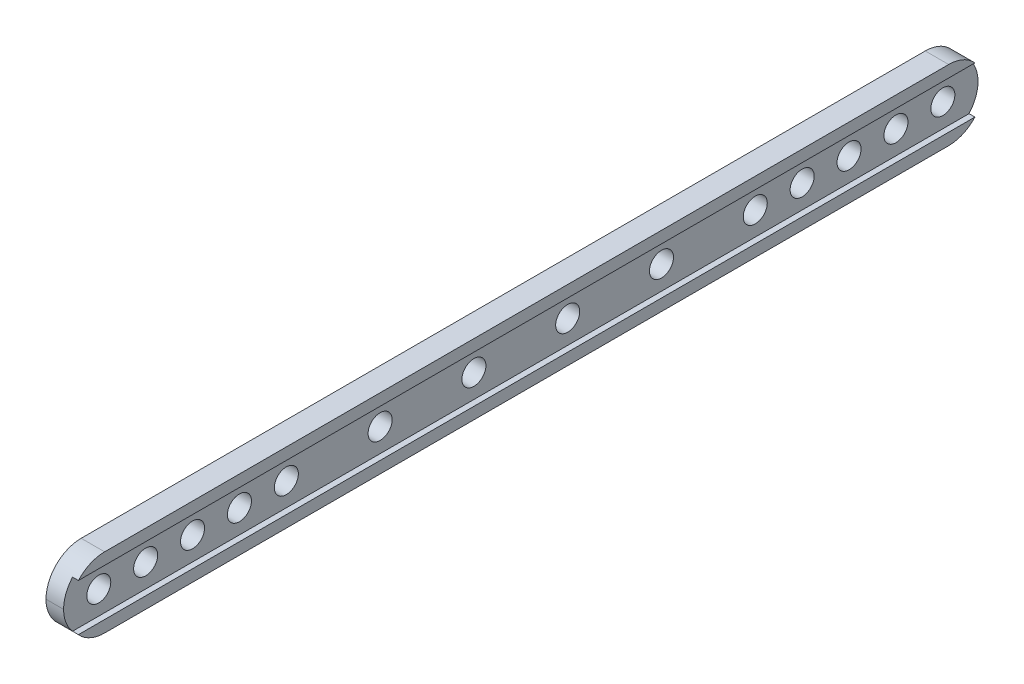
from build123d import *

# Parameters (mm, degrees)
BOSS_EXTRUDE1_DEPTH     = 156
FILLET1_R               = 6
SKETCH2_R               = 2.05
CUT_EXTRUDE1_DEPTH      = 157.511980372
LPATTERN1_COUNT         = 9
LPATTERN1_PITCH         = 8
MIRROR1_COPY_1_SKETCH_R = 2.05
MIRROR1_COPY_1_DEPTH    = 157.511980372
MIRROR1_COPY_2_SKETCH_R = 2.05
MIRROR1_COPY_2_DEPTH    = 157.511980372
MIRROR1_COPY_3_SKETCH_R = 2.05
MIRROR1_COPY_3_DEPTH    = 157.511980372
MIRROR1_COPY_4_SKETCH_R = 2.05
MIRROR1_COPY_4_DEPTH    = 157.511980372
MIRROR1_COPY_5_SKETCH_R = 2.05
MIRROR1_COPY_5_DEPTH    = 157.511980372
MIRROR1_COPY_6_SKETCH_R = 2.05
MIRROR1_COPY_6_DEPTH    = 157.511980372


with BuildPart() as part:
    # Sketch1 → Boss-Extrude1 (new body)
    with BuildSketch(Plane.XY):
        Polygon((0, 0), (4, 0), (4, 2), (3, 2), (3, 10), (4, 10), (4, 12), (0, 12), align=None)
    extrude(amount=-BOSS_EXTRUDE1_DEPTH)

    # Fillet1
    fillet1_edges = [part.edges().sort_by_distance(p)[0] for p in [
        (2, 12, 0),
        (2, 0, 0),
        (2, 0, -156),
        (2, 12, -156),
    ]]
    fillet(fillet1_edges, radius=FILLET1_R - 0.0001)  # a hair under: the kernel refuses the full size

    # Sketch2 → Cut-Extrude1 (cut, through all)
    with BuildSketch(Plane.ZY):
        with Locations(Location((-150, 6, 0), (0, 0, 270))):
            Circle(SKETCH2_R)
    cut_extrude1 = extrude(amount=-CUT_EXTRUDE1_DEPTH, mode=Mode.SUBTRACT)

    # LPattern1: Cut-Extrude1 ×9, 2 skipped
    with Locations(*[(0, 0, i * LPATTERN1_PITCH) for i in range(1, LPATTERN1_COUNT) if i not in (5, 7)]):
        add(cut_extrude1, mode=Mode.SUBTRACT)

    # Mirror1: Cut-Extrude1 across plane
    add(cut_extrude1.mirror(Plane.XY.offset(-78)), mode=Mode.SUBTRACT)

    # Mirror1 copy 1 sketch → Mirror1 copy 1 (cut, through all)
    with BuildSketch(Plane(origin=(0, 0, -164), x_dir=(0, 0, -1), z_dir=(-1, 0, 0))):
        with Locations((-150, -6)):
            Circle(MIRROR1_COPY_1_SKETCH_R)
    extrude(amount=-MIRROR1_COPY_1_DEPTH, mode=Mode.SUBTRACT)

    # Mirror1 copy 2 sketch → Mirror1 copy 2 (cut, through all)
    with BuildSketch(Plane(origin=(0, 0, -172), x_dir=(0, 0, -1), z_dir=(-1, 0, 0))):
        with Locations((-150, -6)):
            Circle(MIRROR1_COPY_2_SKETCH_R)
    extrude(amount=-MIRROR1_COPY_2_DEPTH, mode=Mode.SUBTRACT)

    # Mirror1 copy 3 sketch → Mirror1 copy 3 (cut, through all)
    with BuildSketch(Plane(origin=(0, 0, -180), x_dir=(0, 0, -1), z_dir=(-1, 0, 0))):
        with Locations((-150, -6)):
            Circle(MIRROR1_COPY_3_SKETCH_R)
    extrude(amount=-MIRROR1_COPY_3_DEPTH, mode=Mode.SUBTRACT)

    # Mirror1 copy 4 sketch → Mirror1 copy 4 (cut, through all)
    with BuildSketch(Plane(origin=(0, 0, -188), x_dir=(0, 0, -1), z_dir=(-1, 0, 0))):
        with Locations((-150, -6)):
            Circle(MIRROR1_COPY_4_SKETCH_R)
    extrude(amount=-MIRROR1_COPY_4_DEPTH, mode=Mode.SUBTRACT)

    # Mirror1 copy 5 sketch → Mirror1 copy 5 (cut, through all)
    with BuildSketch(Plane(origin=(0, 0, -204), x_dir=(0, 0, -1), z_dir=(-1, 0, 0))):
        with Locations((-150, -6)):
            Circle(MIRROR1_COPY_5_SKETCH_R)
    extrude(amount=-MIRROR1_COPY_5_DEPTH, mode=Mode.SUBTRACT)

    # Mirror1 copy 6 sketch → Mirror1 copy 6 (cut, through all)
    with BuildSketch(Plane(origin=(0, 0, -220), x_dir=(0, 0, -1), z_dir=(-1, 0, 0))):
        with Locations((-150, -6)):
            Circle(MIRROR1_COPY_6_SKETCH_R)
    extrude(amount=-MIRROR1_COPY_6_DEPTH, mode=Mode.SUBTRACT)


solid = part.part
